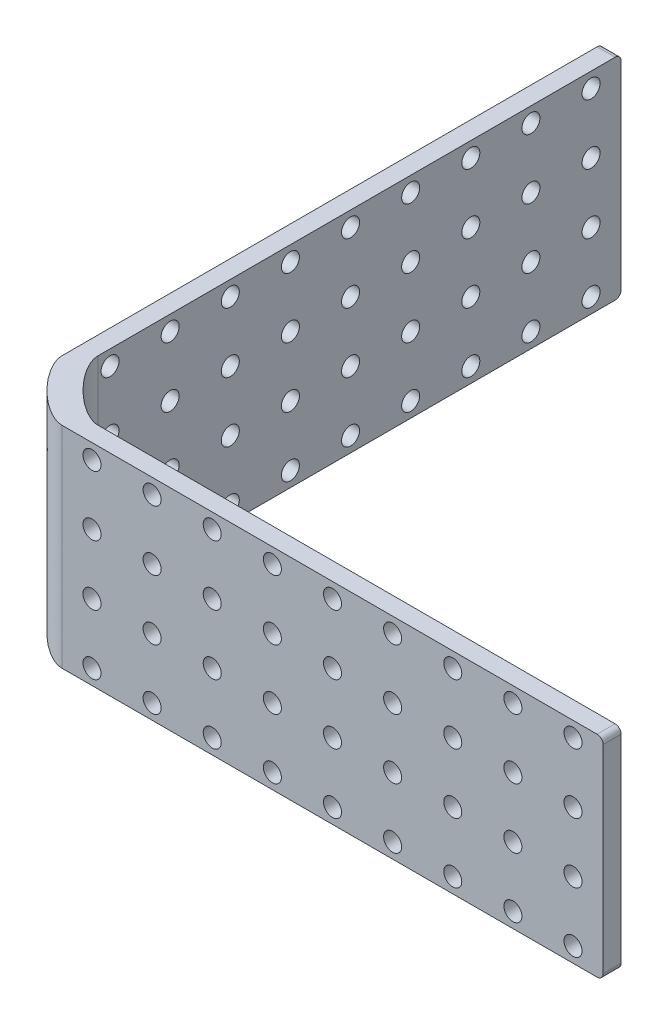
from build123d import *

# Parameters (mm, degrees)
ESQUISSE1_W             = 100
ESQUISSE1_H             = 35
BOSS_EXTRU_1_DEPTH      = 3
ESQUISSE2_R             = 1.5
ENL_V_MAT_EXTRU_1_DEPTH = 3
ESQUISSE5_W             = 100
ESQUISSE5_H             = 35
BOSS_EXTRU_2_DEPTH      = 3
ESQUISSE6_R             = 1.5
ENL_V_MAT_EXTRU_2_DEPTH = 3
CONG_1_SIZE             = 10
CONG_2_R                = 1


with BuildPart() as part:
    # Esquisse1 → Boss.-Extru.1 (new body)
    with BuildSketch(Plane.XY):
        with Locations((50, 17.5)):
            Rectangle(ESQUISSE1_W, ESQUISSE1_H)
    extrude(amount=BOSS_EXTRU_1_DEPTH)

    # Esquisse2 → Enlèv. mat.-Extru.1 (cut)
    with BuildSketch(Plane.XY.offset(3)):
        with Locations((95, 32.5)):
            Circle(ESQUISSE2_R)
        with Locations((85, 32.5)):
            Circle(ESQUISSE2_R)
        with Locations((75, 32.5)):
            Circle(ESQUISSE2_R)
        with Locations((65, 32.5)):
            Circle(ESQUISSE2_R)
        with Locations((55, 32.5)):
            Circle(ESQUISSE2_R)
        with Locations((45, 32.5)):
            Circle(ESQUISSE2_R)
        with Locations((35, 32.5)):
            Circle(ESQUISSE2_R)
        with Locations((25, 32.5)):
            Circle(ESQUISSE2_R)
        with Locations((15, 32.5)):
            Circle(ESQUISSE2_R)
        with Locations((85, 22.5)):
            Circle(ESQUISSE2_R)
        with Locations((75, 22.5)):
            Circle(ESQUISSE2_R)
        with Locations((65, 22.5)):
            Circle(ESQUISSE2_R)
        with Locations((55, 22.5)):
            Circle(ESQUISSE2_R)
        with Locations((45, 22.5)):
            Circle(ESQUISSE2_R)
        with Locations((35, 22.5)):
            Circle(ESQUISSE2_R)
        with Locations((25, 22.5)):
            Circle(ESQUISSE2_R)
        with Locations((15, 22.5)):
            Circle(ESQUISSE2_R)
        with Locations((85, 12.5)):
            Circle(ESQUISSE2_R)
        with Locations((75, 12.5)):
            Circle(ESQUISSE2_R)
        with Locations((65, 12.5)):
            Circle(ESQUISSE2_R)
        with Locations((55, 12.5)):
            Circle(ESQUISSE2_R)
        with Locations((45, 12.5)):
            Circle(ESQUISSE2_R)
        with Locations((35, 12.5)):
            Circle(ESQUISSE2_R)
        with Locations((25, 12.5)):
            Circle(ESQUISSE2_R)
        with Locations((15, 12.5)):
            Circle(ESQUISSE2_R)
        with Locations((85, 2.5)):
            Circle(ESQUISSE2_R)
        with Locations((75, 2.5)):
            Circle(ESQUISSE2_R)
        with Locations((65, 2.5)):
            Circle(ESQUISSE2_R)
        with Locations((55, 2.5)):
            Circle(ESQUISSE2_R)
        with Locations((45, 2.5)):
            Circle(ESQUISSE2_R)
        with Locations((35, 2.5)):
            Circle(ESQUISSE2_R)
        with Locations((25, 2.5)):
            Circle(ESQUISSE2_R)
        with Locations((15, 2.5)):
            Circle(ESQUISSE2_R)
        with Locations((95, 22.5)):
            Circle(ESQUISSE2_R)
        with Locations((95, 12.5)):
            Circle(ESQUISSE2_R)
        with Locations((95, 2.5)):
            Circle(ESQUISSE2_R)
    extrude(amount=-ENL_V_MAT_EXTRU_1_DEPTH, mode=Mode.SUBTRACT)

    # Esquisse5 → Boss.-Extru.2 (add)
    with BuildSketch(Plane.ZY):
        with Locations((-47, 17.5)):
            Rectangle(ESQUISSE5_W, ESQUISSE5_H)
    extrude(amount=-BOSS_EXTRU_2_DEPTH)

    # Esquisse6 → Enlèv. mat.-Extru.2 (cut)
    with BuildSketch(Plane(origin=(3, 0, 0), x_dir=(0, 0, -1), z_dir=(1, 0, 0))):
        with Locations((92, 32.5)):
            Circle(ESQUISSE6_R)
        with Locations((82, 32.5)):
            Circle(ESQUISSE6_R)
        with Locations((72, 32.5)):
            Circle(ESQUISSE6_R)
        with Locations((62, 32.5)):
            Circle(ESQUISSE6_R)
        with Locations((52, 32.5)):
            Circle(ESQUISSE6_R)
        with Locations((42, 32.5)):
            Circle(ESQUISSE6_R)
        with Locations((32, 32.5)):
            Circle(ESQUISSE6_R)
        with Locations((22, 32.5)):
            Circle(ESQUISSE6_R)
        with Locations((12, 32.5)):
            Circle(ESQUISSE6_R)
        with Locations((82, 22.5)):
            Circle(ESQUISSE6_R)
        with Locations((72, 22.5)):
            Circle(ESQUISSE6_R)
        with Locations((62, 22.5)):
            Circle(ESQUISSE6_R)
        with Locations((52, 22.5)):
            Circle(ESQUISSE6_R)
        with Locations((42, 22.5)):
            Circle(ESQUISSE6_R)
        with Locations((32, 22.5)):
            Circle(ESQUISSE6_R)
        with Locations((22, 22.5)):
            Circle(ESQUISSE6_R)
        with Locations((12, 22.5)):
            Circle(ESQUISSE6_R)
        with Locations((82, 12.5)):
            Circle(ESQUISSE6_R)
        with Locations((72, 12.5)):
            Circle(ESQUISSE6_R)
        with Locations((62, 12.5)):
            Circle(ESQUISSE6_R)
        with Locations((52, 12.5)):
            Circle(ESQUISSE6_R)
        with Locations((42, 12.5)):
            Circle(ESQUISSE6_R)
        with Locations((32, 12.5)):
            Circle(ESQUISSE6_R)
        with Locations((22, 12.5)):
            Circle(ESQUISSE6_R)
        with Locations((12, 12.5)):
            Circle(ESQUISSE6_R)
        with Locations((82, 2.5)):
            Circle(ESQUISSE6_R)
        with Locations((72, 2.5)):
            Circle(ESQUISSE6_R)
        with Locations((62, 2.5)):
            Circle(ESQUISSE6_R)
        with Locations((52, 2.5)):
            Circle(ESQUISSE6_R)
        with Locations((42, 2.5)):
            Circle(ESQUISSE6_R)
        with Locations((32, 2.5)):
            Circle(ESQUISSE6_R)
        with Locations((22, 2.5)):
            Circle(ESQUISSE6_R)
        with Locations((12, 2.5)):
            Circle(ESQUISSE6_R)
        with Locations((92, 22.5)):
            Circle(ESQUISSE6_R)
        with Locations((92, 12.5)):
            Circle(ESQUISSE6_R)
        with Locations((92, 2.5)):
            Circle(ESQUISSE6_R)
    extrude(amount=-ENL_V_MAT_EXTRU_2_DEPTH, mode=Mode.SUBTRACT)

    # Congé1
    # a fillet whose section is not a circle: 10 mm, written as the material it adds along each edge
    with BuildSketch(Plane(origin=(3, 35, 0), x_dir=(1, 0, 0), z_dir=(0, -1, 0))) as cong_1_piece_1:
        with BuildLine():
            Bezier((CONG_1_SIZE, 0), (0, 0), (0, -CONG_1_SIZE), weights=[1, 0.333333333, 1])
            Line((0, -CONG_1_SIZE), (0, 0))
            Line((0, 0), (CONG_1_SIZE, 0))
        make_face()
    extrude(amount=35)
    # a fillet whose section is not a circle: 10 mm, written as the material it takes off along each edge
    with BuildSketch(Plane(origin=(0, 60, 3), x_dir=(1, 0, 0), z_dir=(0, -1, 0))) as cong_1_2_piece_1:
        with BuildLine():
            Bezier((CONG_1_SIZE, 0), (0, 0), (0, -CONG_1_SIZE), weights=[1, 0.333333333, 1])
            Line((0, -CONG_1_SIZE), (0, 0))
            Line((0, 0), (CONG_1_SIZE, 0))
        make_face()
    extrude(amount=85, mode=Mode.SUBTRACT)

    # Congé2
    cong_2_edges = [part.edges().sort_by_distance(p)[0] for p in [
        (100, 35, 1.5),
        (100, 0, 1.5),
        (1.5, 0, -97),
        (1.5, 35, -97),
    ]]
    fillet(cong_2_edges, radius=CONG_2_R)


solid = part.part
